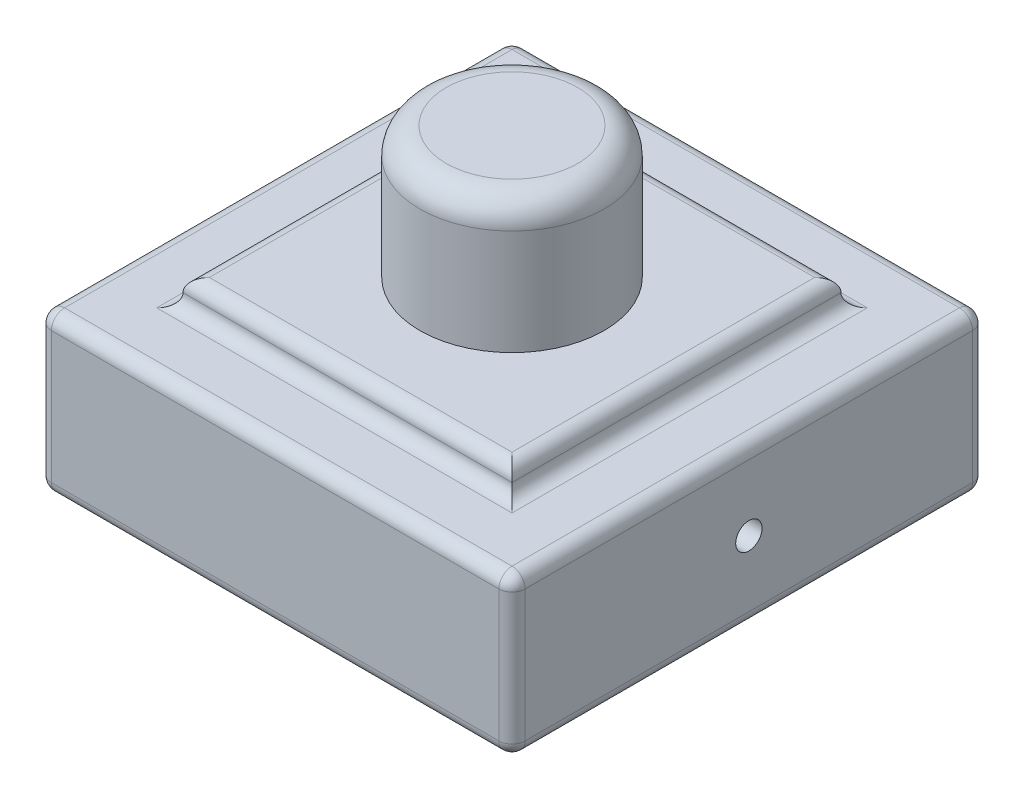
from build123d import *

# Parameters (mm, degrees)
SKETCH_1_W          = 36
SKETCH_1_H          = 36
EXTRUDE_1_DEPTH     = 12
SKETCH_2_W          = 25
SKETCH_2_H          = 25
EXTRUDE_2_DEPTH     = 2
SKETCH_3_R          = 7
EXTRUDE_3_DEPTH     = 10
FILLET_1_R          = 2
FILLET_2_R          = 1
FILLET_3_R          = 1
SKETCH_4_R          = 1
CUT_EXTRUDE_1_DEPTH = 50


with BuildPart() as part:
    # 草图1 → 凸台-拉伸1 (new body)
    with BuildSketch(Plane(origin=(0, 0, 0), x_dir=(1, 0, 0), z_dir=(0, 1, 0))):
        Rectangle(SKETCH_1_W, SKETCH_1_H)
    extrude(amount=EXTRUDE_1_DEPTH)

    # 草图2 → 凸台-拉伸2 (add)
    with BuildSketch(Plane(origin=(0, 12, 0), x_dir=(1, 0, 0), z_dir=(0, 1, 0))):
        Rectangle(SKETCH_2_W, SKETCH_2_H)
    extrude(amount=EXTRUDE_2_DEPTH)

    # 草图3 → 凸台-拉伸3 (add)
    with BuildSketch(Plane(origin=(0, 14, 0), x_dir=(1, 0, 0), z_dir=(0, 1, 0))):
        with Locations(Location((0, 0, 0), (0, 0, 270))):
            Circle(SKETCH_3_R)
    extrude(amount=EXTRUDE_3_DEPTH)

    # 圆角1
    fillet_1_edges = [part.edges().sort_by_distance(p)[0] for p in [
        (0, 24, -7),
    ]]
    fillet(fillet_1_edges, radius=FILLET_1_R)

    # 圆角2
    fillet_2_edges = [part.edges().sort_by_distance(p)[0] for p in [
        (0, 12, -12.5),
        (12.5, 12, 0),
        (0, 12, 12.5),
        (-12.5, 14, 0),
        (-12.5, 12, 0),
        (0, 14, 12.5),
        (12.5, 14, 0),
        (0, 14, -12.5),
    ]]
    fillet(fillet_2_edges, radius=FILLET_2_R - 0.0001)  # a hair under: the kernel refuses the full size

    # 圆角3
    fillet_3_edges = [part.edges().sort_by_distance(p)[0] for p in [
        (-18, 12, 0),
        (0, 12, 18),
        (18, 12, 0),
        (0, 0, 18),
        (-18, 0, 0),
        (0, 0, -18),
        (18, 0, 0),
        (18, 6, 18),
        (-18, 6, 18),
        (-18, 6, -18),
        (18, 6, -18),
        (0, 12, -18),
    ]]
    fillet(fillet_3_edges, radius=FILLET_3_R)

    # 草图4 → 切除-拉伸1 (cut)
    with BuildSketch(Plane(origin=(18, 0, 0), x_dir=(0, 0, -1), z_dir=(1, 0, 0))):
        with Locations((0, 6)):
            Circle(SKETCH_4_R)
    extrude(amount=-CUT_EXTRUDE_1_DEPTH, mode=Mode.SUBTRACT)


solid = part.part
